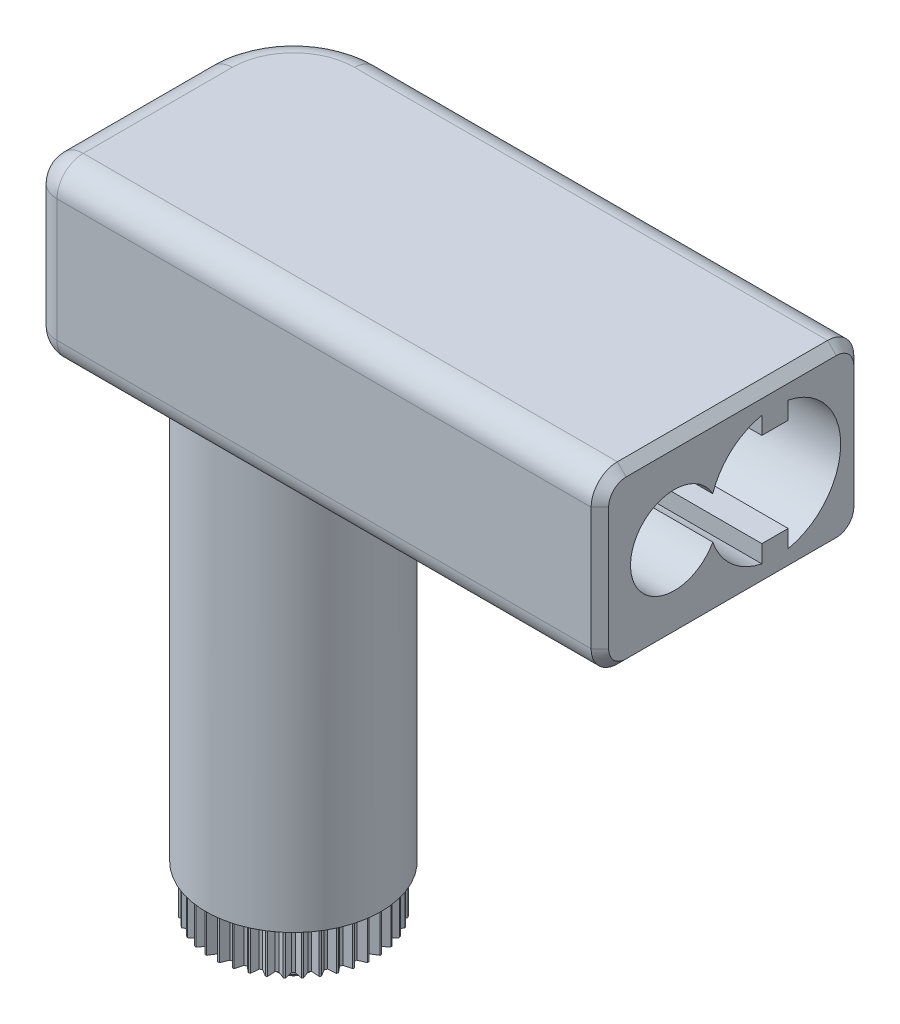
from build123d import *

# Parameters (mm, degrees)
SKETCH1_W               = 30
SKETCH1_H               = 40
BOSS_EXTRUDE1_DEPTH     = 3
FILLET1_R               = 5
CHAMFER1_SIZE           = 0.5
SKETCH2_R               = 2.5
CUT_EXTRUDE1_DEPTH      = 26.179356624
SKETCH3_R               = 4
CUT_EXTRUDE2_DEPTH      = 1
SKETCH4_R               = 10
BOSS_EXTRUDE2_DEPTH     = 100
BOSS_EXTRUDE3_START     = -20
BOSS_EXTRUDE3_DEPTH     = 20
CUT_EXTRUDE3_DEPTH      = 65
FILLET3_R               = 3
CHAMFER2_SIZE           = 1
CUT_EXTRUDE4_DEPTH      = 119.465184892
CUT_EXTRUDE4_DEPTH_BACK = 119.465184892
SKETCH7_W               = 46.824813565
SKETCH7_H               = 30.07224097
SKETCH8_R               = 3
BOSS_EXTRUDE4_DEPTH     = 1
SKETCH9_R               = 2.4
BOSS_EXTRUDE5_DEPTH     = 4
CHAMFER3_SIZE           = 0.5
CUT_EXTRUDE5_DEPTH      = 5
SKETCH19_R              = 10
SKETCH19_R_2            = 9.3
CUT_EXTRUDE6_DEPTH      = 5


with BuildPart() as part:
    # Sketch1 → Boss-Extrude1 (new body)
    with BuildSketch(Plane(origin=(0, 0, 0), x_dir=(1, 0, 0), z_dir=(0, 1, 0))):
        Rectangle(SKETCH1_W, SKETCH1_H)
    extrude(amount=BOSS_EXTRUDE1_DEPTH)

    # Fillet1
    fillet1_edges = [part.edges().sort_by_distance(p)[0] for p in [
        (15, 1.5, 20),
        (-15, 1.5, 20),
        (-15, 1.5, -20),
        (15, 1.5, -20),
    ]]
    fillet(fillet1_edges, radius=FILLET1_R)

    # Chamfer1
    chamfer1_edges = [part.edges().sort_by_distance(p)[0] for p in [
        (-15, 0, 0),
        (-15, 3, 0),
        (15, 0, 0),
        (0, 0, 20),
        (0, 0, -20),
        (-13.535533906, 0, 18.535533906),
        (13.535533906, 0, 18.535533906),
        (13.535533906, 0, -18.535533906),
        (-13.535533906, 0, -18.535533906),
        (0, 3, -20),
        (15, 3, 0),
        (0, 3, 20),
        (-13.535533906, 3, 18.535533906),
        (13.535533906, 3, 18.535533906),
        (13.535533906, 3, -18.535533906),
        (-13.535533906, 3, -18.535533906),
    ]]
    chamfer(chamfer1_edges, length=CHAMFER1_SIZE)

    # Sketch2 → Cut-Extrude1 (cut, through all)
    with BuildSketch(Plane(origin=(0, 3, 0), x_dir=(1, 0, 0), z_dir=(0, 1, 0))):
        with Locations(Location((-10, 15, 0), (0, 0, 270))):
            Circle(SKETCH2_R)
        with Locations(Location((10, 15, 0), (0, 0, 90))):
            Circle(SKETCH2_R)
        with Locations(Location((10, -15, 0), (0, 0, 270))):
            Circle(SKETCH2_R)
        with Locations(Location((-10, -15, 0), (0, 0, 90))):
            Circle(SKETCH2_R)
    extrude(amount=-CUT_EXTRUDE1_DEPTH, mode=Mode.SUBTRACT)

    # Sketch3 → Cut-Extrude2 (cut)
    with BuildSketch(Plane(origin=(0, 3, 0), x_dir=(1, 0, 0), z_dir=(0, 1, 0))):
        with Locations(Location((-10, 15, 0), (0, 0, 270))):
            Circle(SKETCH3_R)
        with Locations(Location((10, 15, 0), (0, 0, 270))):
            Circle(SKETCH3_R)
        with Locations(Location((10, -15, 0), (0, 0, 270))):
            Circle(SKETCH3_R)
        with Locations(Location((-10, -15, 0), (0, 0, 270))):
            Circle(SKETCH3_R)
    extrude(amount=-CUT_EXTRUDE2_DEPTH, mode=Mode.SUBTRACT)

    # Sketch4 → Boss-Extrude2 (add)
    with BuildSketch(Plane(origin=(0, 3, 0), x_dir=(1, 0, 0), z_dir=(0, 1, 0))):
        with Locations(Location((0, 0, 0), (0, 0, 90))):
            Circle(SKETCH4_R)
    extrude(amount=BOSS_EXTRUDE2_DEPTH)

    # Sketch5 → Boss-Extrude3 (add)
    with BuildSketch(Plane(origin=(0, 103, 0), x_dir=(1, 0, 0), z_dir=(0, 1, 0)).offset(BOSS_EXTRUDE3_START)):
        with BuildLine():
            Line((0, 10), (55, 10))
            Line((55, 10), (55, -20))
            Line((55, -20), (-10, -20))
            Line((-10, -20), (-10, 0))
            ThreePointArc((-10, 0), (-7.071067812, 7.071067812), (0, 10))
        make_face()
    extrude(amount=BOSS_EXTRUDE3_DEPTH)

    # Sketch6 → Cut-Extrude3 (cut)
    with BuildSketch(Plane(origin=(55, 0, 0), x_dir=(0, 0, -1), z_dir=(1, 0, 0))):
        with BuildLine():
            Line((-1.5, 100.348469228), (-1.5, 98.348469228))
            Line((-1.5, 98.348469228), (1.5, 98.348469228))
            Line((1.5, 98.348469228), (1.5, 100.348469228))
            ThreePointArc((1.5, 100.348469228), (7.5, 93), (1.5, 85.651530772))
            Line((1.5, 85.651530772), (1.5, 87.651530772))
            Line((1.5, 87.651530772), (-1.5, 87.651530772))
            Line((-1.5, 87.651530772), (-1.5, 85.651530772))
            ThreePointArc((-1.5, 85.651530772), (-4.967067638, 87.380548151), (-7.108695652, 90.609090942))
            ThreePointArc((-7.108695652, 90.609090942), (-16.5, 93), (-7.108695652, 95.390909058))
            ThreePointArc((-7.108695652, 95.390909058), (-4.967067638, 98.619451849), (-1.5, 100.348469228))
        make_face()
    extrude(amount=-CUT_EXTRUDE3_DEPTH, mode=Mode.SUBTRACT)

    # Fillet3
    # the kernel refuses this fillet: 3 mm, written as the material it takes off along each edge
    with BuildSketch(Plane(origin=(-7, 100, 17), x_dir=(0, 0, 1), z_dir=(-1, 0, 0))) as fillet3_piece_1_section:
        Polygon((0, 0), (FILLET3_R * 1.02, 0), (FILLET3_R * 1.02, FILLET3_R * 1.02), (0, FILLET3_R * 1.02), align=None)
    fillet3_piece_1 = extrude(amount=FILLET3_R * 1.02, mode=Mode.PRIVATE)
    fillet3_piece_1 = fillet3_piece_1 - Plane(origin=(-7, 100, 17), x_dir=(0, -0.7071067811865475, -0.7071067811865475), z_dir=(-1, 0, 0)) * Sphere(FILLET3_R, mode=Mode.PRIVATE)
    add(fillet3_piece_1, mode=Mode.SUBTRACT)
    with BuildSketch(Plane(origin=(-7, 86, 17), x_dir=(-1, 0, 0), z_dir=(0, 0, 1))) as fillet3_piece_2_section:
        Polygon((0, 0), (FILLET3_R * 1.02, 0), (FILLET3_R * 1.02, FILLET3_R * 1.02), (0, FILLET3_R * 1.02), align=None)
    fillet3_piece_2 = extrude(amount=FILLET3_R * 1.02, mode=Mode.PRIVATE)
    fillet3_piece_2 = fillet3_piece_2 - Plane(origin=(-7, 86, 17), x_dir=(0.7071067811865475, 0.7071067811865475, 0), z_dir=(0, 0, 1)) * Sphere(FILLET3_R, mode=Mode.PRIVATE)
    add(fillet3_piece_2, mode=Mode.SUBTRACT)
    with BuildSketch(Plane(origin=(0, 103, 0), x_dir=(0, 0, -1), z_dir=(1, 0, 0))) as fillet3_piece_3:
        with BuildLine():
            CenterArc((10 - FILLET3_R, -FILLET3_R), FILLET3_R, 0, 90)
            Line((10 - FILLET3_R, 0), (10, 0))
            Line((10, 0), (10, -FILLET3_R))
        make_face()
    revolve(axis=Axis((0, 103, 0), (0, 1, 0)), revolution_arc=90, mode=Mode.SUBTRACT)
    with BuildSketch(Plane(origin=(0, 103, -10), x_dir=(0, 0, 1), z_dir=(1, 0, 0))) as fillet3_piece_4:
        with BuildLine():
            CenterArc((FILLET3_R, FILLET3_R), FILLET3_R, 180, 90)
            Line((0, FILLET3_R), (0, 0))
            Line((0, 0), (FILLET3_R, 0))
        make_face()
    extrude(amount=62.5, mode=Mode.SUBTRACT)
    with BuildSketch(Plane(origin=(-10, 103, 17), x_dir=(0, -1, 0), z_dir=(0, 0, -1))) as fillet3_piece_5:
        with BuildLine():
            CenterArc((FILLET3_R, -FILLET3_R), FILLET3_R, 90, 90)
            Line((0, -FILLET3_R), (0, 0))
            Line((0, 0), (FILLET3_R, 0))
        make_face()
    extrude(amount=17, mode=Mode.SUBTRACT)
    with BuildSketch(Plane(origin=(62.5, 103, 20), x_dir=(0, 0, -1), z_dir=(-1, 0, 0))) as fillet3_piece_6:
        with BuildLine():
            CenterArc((FILLET3_R, FILLET3_R), FILLET3_R, 180, 90)
            Line((0, FILLET3_R), (0, 0))
            Line((0, 0), (FILLET3_R, 0))
        make_face()
    extrude(amount=69.5, mode=Mode.SUBTRACT)
    with BuildSketch(Plane(origin=(-7.5, 83, -10), x_dir=(0, 0, 1), z_dir=(1, 0, 0))) as fillet3_piece_7_section:
        with BuildLine():
            CenterArc((FILLET3_R, -FILLET3_R), FILLET3_R, 90, 90)
            Line((0, -FILLET3_R), (0, 0))
            Line((0, 0), (FILLET3_R, 0))
        make_face()
    fillet3_piece_7 = extrude(amount=70, mode=Mode.PRIVATE)
    fillet3_piece_7 = fillet3_piece_7 - Plane(origin=(0, 83.680284566, 0), x_dir=(0, 0, -1), z_dir=(0, -1, 0)) * Cylinder(10, 152, mode=Mode.PRIVATE)
    add(fillet3_piece_7, mode=Mode.SUBTRACT)
    with BuildSketch(Plane(origin=(62.5, 83, 20), x_dir=(0, 0, -1), z_dir=(-1, 0, 0))) as fillet3_piece_8:
        with BuildLine():
            CenterArc((FILLET3_R, -FILLET3_R), FILLET3_R, 90, 90)
            Line((0, -FILLET3_R), (0, 0))
            Line((0, 0), (FILLET3_R, 0))
        make_face()
    extrude(amount=69.5, mode=Mode.SUBTRACT)
    with BuildSketch(Plane(origin=(-10, 83, 17), x_dir=(1, 0, 0), z_dir=(0, 0, -1))) as fillet3_piece_9_section:
        with BuildLine():
            CenterArc((FILLET3_R, -FILLET3_R), FILLET3_R, 90, 90)
            Line((0, -FILLET3_R), (0, 0))
            Line((0, 0), (FILLET3_R, 0))
        make_face()
    fillet3_piece_9 = extrude(amount=24.5, mode=Mode.PRIVATE)
    fillet3_piece_9 = fillet3_piece_9 - Plane(origin=(0, 83.705023948, 0), x_dir=(0, 0, -1), z_dir=(0, -1, 0)) * Cylinder(10, 61, mode=Mode.PRIVATE)
    add(fillet3_piece_9, mode=Mode.SUBTRACT)
    with BuildSketch(Plane(origin=(-10, 86, 20), x_dir=(0, 0, -1), z_dir=(0, 1, 0))) as fillet3_piece_10:
        with BuildLine():
            CenterArc((FILLET3_R, -FILLET3_R), FILLET3_R, 90, 90)
            Line((0, -FILLET3_R), (0, 0))
            Line((0, 0), (FILLET3_R, 0))
        make_face()
    extrude(amount=14, mode=Mode.SUBTRACT)

    # Chamfer2
    chamfer2_edges = [part.edges().sort_by_distance(p)[0] for p in [
        (55, 103, 5),
        (55, 93, -10),
        (55, 83, 5),
        (55, 93, 20),
        (55, 102.121320344, -9.121320344),
        (55, 102.121320344, 19.121320344),
        (55, 83.878679656, 19.121320344),
        (55, 83.878679656, -9.121320344),
    ]]
    chamfer(chamfer2_edges, length=CHAMFER2_SIZE)

    # Sketch7 → Cut-Extrude4 (cut, two sides: drawn at the far end of the back side and taken through both)
    with BuildSketch(Plane.XY.offset(-CUT_EXTRUDE4_DEPTH_BACK)):
        with Locations((-1.764612757, 7.963879515)):
            Rectangle(SKETCH7_W, SKETCH7_H)
    extrude(amount=CUT_EXTRUDE4_DEPTH + CUT_EXTRUDE4_DEPTH_BACK, mode=Mode.SUBTRACT)

    # Sketch8 → Boss-Extrude4 (add)
    with BuildSketch(Plane.XZ.offset(-23)):
        with Locations(Location((0, 0, 0), (0, 0, 270))):
            Circle(SKETCH8_R)
    extrude(amount=BOSS_EXTRUDE4_DEPTH)

    # Sketch9 → Boss-Extrude5 (add)
    with BuildSketch(Plane.XZ.offset(-22)):
        with Locations(Location((0, 0, 0), (0, 0, 270))):
            Circle(SKETCH9_R)
    extrude(amount=BOSS_EXTRUDE5_DEPTH)

    # Chamfer3
    chamfer3_edges = [part.edges().sort_by_distance(p)[0] for p in [
        (0, 18, 2.4),
    ]]
    chamfer(chamfer3_edges, length=CHAMFER3_SIZE)

    # Sketch18 → Cut-Extrude5 (cut)
    with BuildSketch(Plane.XZ.offset(-23)):
        Polygon((-0.636278529, 9.27820832), (-0.15, 8.5), (0.15, 8.5), (0.636278529, 9.27820832), (0, 10.668150993), align=None)
        Polygon((1.668866493, 10.536808351), (0.822986671, 9.263514071), (1.181539702, 8.418816065), (1.477846204, 8.371885725), (2.079876439, 9.064442288), align=None)
        Polygon((3.296639955, 10.146014518), (2.261987207, 9.020721361), (2.483985975, 8.130332938), (2.76930293, 8.037627839), (3.472260889, 8.627479604), align=None)
        Polygon((4.8432392, 9.505392135), (3.645290112, 8.555808553), (3.725268269, 7.641654031), (3.992570226, 7.505456881), (4.779146752, 7.978079739), align=None)
        Polygon((6.270581823, 8.630715452), (4.938833875, 7.880223344), (4.874822095, 6.96481224), (5.117527194, 6.788476664), (5.968354161, 7.132233073), align=None)
        Polygon((7.54352191, 7.54352191), (6.110767158, 7.010600883), (5.904341623, 6.116473657), (6.116473657, 5.904341623), (7.010600883, 6.110767158), align=None)
        Polygon((8.630715452, 6.270581823), (7.132233073, 5.968354161), (6.788476664, 5.117527194), (6.96481224, 4.874822095), (7.880223344, 4.938833876), align=None)
        Polygon((9.505392135, 4.8432392), (7.978079739, 4.779146752), (7.505456881, 3.992570226), (7.641654031, 3.725268269), (8.555808553, 3.645290112), align=None)
        Polygon((10.146014518, 3.296639955), (8.627479604, 3.472260889), (8.037627839, 2.76930293), (8.130332938, 2.483985975), (9.020721361, 2.261987207), align=None)
        Polygon((10.536808351, 1.668866493), (9.064442288, 2.079876439), (8.371885725, 1.477846204), (8.418816065, 1.181539702), (9.263514071, 0.822986671), align=None)
        Polygon((10.668150993, 0), (9.27820832, 0.636278529), (8.5, 0.15), (8.5, -0.15), (9.27820832, -0.636278529), align=None)
        Polygon((10.536808351, -1.668866493), (9.263514071, -0.822986671), (8.418816065, -1.181539702), (8.371885725, -1.477846204), (9.064442288, -2.079876439), align=None)
        Polygon((10.146014518, -3.296639955), (9.020721361, -2.261987207), (8.130332938, -2.483985975), (8.037627839, -2.76930293), (8.627479604, -3.472260889), align=None)
        Polygon((9.505392135, -4.8432392), (8.555808553, -3.645290112), (7.641654031, -3.725268269), (7.505456881, -3.992570226), (7.978079739, -4.779146752), align=None)
        Polygon((8.630715452, -6.270581823), (7.880223344, -4.938833875), (6.96481224, -4.874822095), (6.788476664, -5.117527194), (7.132233073, -5.968354161), align=None)
        Polygon((7.54352191, -7.54352191), (7.010600883, -6.110767158), (6.116473657, -5.904341623), (5.904341623, -6.116473657), (6.110767158, -7.010600883), align=None)
        Polygon((6.270581823, -8.630715452), (5.968354161, -7.132233073), (5.117527194, -6.788476664), (4.874822095, -6.96481224), (4.938833876, -7.880223344), align=None)
        Polygon((4.8432392, -9.505392135), (4.779146752, -7.978079739), (3.992570226, -7.505456881), (3.725268269, -7.641654031), (3.645290112, -8.555808553), align=None)
        Polygon((3.296639955, -10.146014518), (3.472260889, -8.627479604), (2.76930293, -8.037627839), (2.483985975, -8.130332938), (2.261987207, -9.020721361), align=None)
        Polygon((1.668866493, -10.536808351), (2.079876439, -9.064442288), (1.477846204, -8.371885725), (1.181539702, -8.418816065), (0.822986671, -9.263514071), align=None)
        Polygon((0, -10.668150993), (0.636278529, -9.27820832), (0.15, -8.5), (-0.15, -8.5), (-0.636278529, -9.27820832), align=None)
        Polygon((-1.668866493, -10.536808351), (-0.822986671, -9.263514071), (-1.181539702, -8.418816065), (-1.477846204, -8.371885725), (-2.079876439, -9.064442288), align=None)
        Polygon((-3.296639955, -10.146014518), (-2.261987207, -9.020721361), (-2.483985975, -8.130332938), (-2.76930293, -8.037627839), (-3.472260889, -8.627479604), align=None)
        Polygon((-4.8432392, -9.505392135), (-3.645290112, -8.555808553), (-3.725268269, -7.641654031), (-3.992570226, -7.505456881), (-4.779146752, -7.978079739), align=None)
        Polygon((-6.270581823, -8.630715452), (-4.938833875, -7.880223344), (-4.874822095, -6.96481224), (-5.117527194, -6.788476664), (-5.968354161, -7.132233073), align=None)
        Polygon((-7.54352191, -7.54352191), (-6.110767158, -7.010600883), (-5.904341623, -6.116473657), (-6.116473657, -5.904341623), (-7.010600883, -6.110767158), align=None)
        Polygon((-8.630715452, -6.270581823), (-7.132233073, -5.968354161), (-6.788476664, -5.117527194), (-6.96481224, -4.874822095), (-7.880223344, -4.938833876), align=None)
        Polygon((-9.505392135, -4.8432392), (-7.978079739, -4.779146752), (-7.505456881, -3.992570226), (-7.641654031, -3.725268269), (-8.555808553, -3.645290112), align=None)
        Polygon((-10.146014518, -3.296639955), (-8.627479604, -3.472260889), (-8.037627839, -2.76930293), (-8.130332938, -2.483985975), (-9.020721361, -2.261987207), align=None)
        Polygon((-10.536808351, -1.668866493), (-9.064442288, -2.079876439), (-8.371885725, -1.477846204), (-8.418816065, -1.181539702), (-9.263514071, -0.822986671), align=None)
        Polygon((-10.668150993, 0), (-9.27820832, -0.636278529), (-8.5, -0.15), (-8.5, 0.15), (-9.27820832, 0.636278529), align=None)
        Polygon((-10.536808351, 1.668866493), (-9.263514071, 0.822986671), (-8.418816065, 1.181539702), (-8.371885725, 1.477846204), (-9.064442288, 2.079876439), align=None)
        Polygon((-10.146014518, 3.296639955), (-9.020721361, 2.261987207), (-8.130332938, 2.483985975), (-8.037627839, 2.76930293), (-8.627479604, 3.472260889), align=None)
        Polygon((-9.505392135, 4.8432392), (-8.555808553, 3.645290112), (-7.641654031, 3.725268269), (-7.505456881, 3.992570226), (-7.978079739, 4.779146752), align=None)
        Polygon((-8.630715452, 6.270581823), (-7.880223344, 4.938833875), (-6.96481224, 4.874822095), (-6.788476664, 5.117527194), (-7.132233073, 5.968354161), align=None)
        Polygon((-7.54352191, 7.54352191), (-7.010600883, 6.110767158), (-6.116473657, 5.904341623), (-5.904341623, 6.116473657), (-6.110767158, 7.010600883), align=None)
        Polygon((-6.270581823, 8.630715452), (-5.968354161, 7.132233073), (-5.117527194, 6.788476664), (-4.874822095, 6.96481224), (-4.938833876, 7.880223344), align=None)
        Polygon((-4.8432392, 9.505392135), (-4.779146752, 7.978079739), (-3.992570226, 7.505456881), (-3.725268269, 7.641654031), (-3.645290112, 8.555808553), align=None)
        Polygon((-3.296639955, 10.146014518), (-3.472260889, 8.627479604), (-2.76930293, 8.037627839), (-2.483985975, 8.130332938), (-2.261987207, 9.020721361), align=None)
        Polygon((-1.668866493, 10.536808351), (-2.079876439, 9.064442288), (-1.477846204, 8.371885725), (-1.181539702, 8.418816065), (-0.822986671, 9.263514071), align=None)
    extrude(amount=-CUT_EXTRUDE5_DEPTH, mode=Mode.SUBTRACT)

    # Sketch19 → Cut-Extrude6 (cut)
    with BuildSketch(Plane.XZ.offset(-23)):
        with Locations(Location((0, 0, 0), (0, 0, 270))):
            Circle(SKETCH19_R)
        Circle(SKETCH19_R_2, mode=Mode.SUBTRACT)
    extrude(amount=-CUT_EXTRUDE6_DEPTH, mode=Mode.SUBTRACT)


solid = part.part
